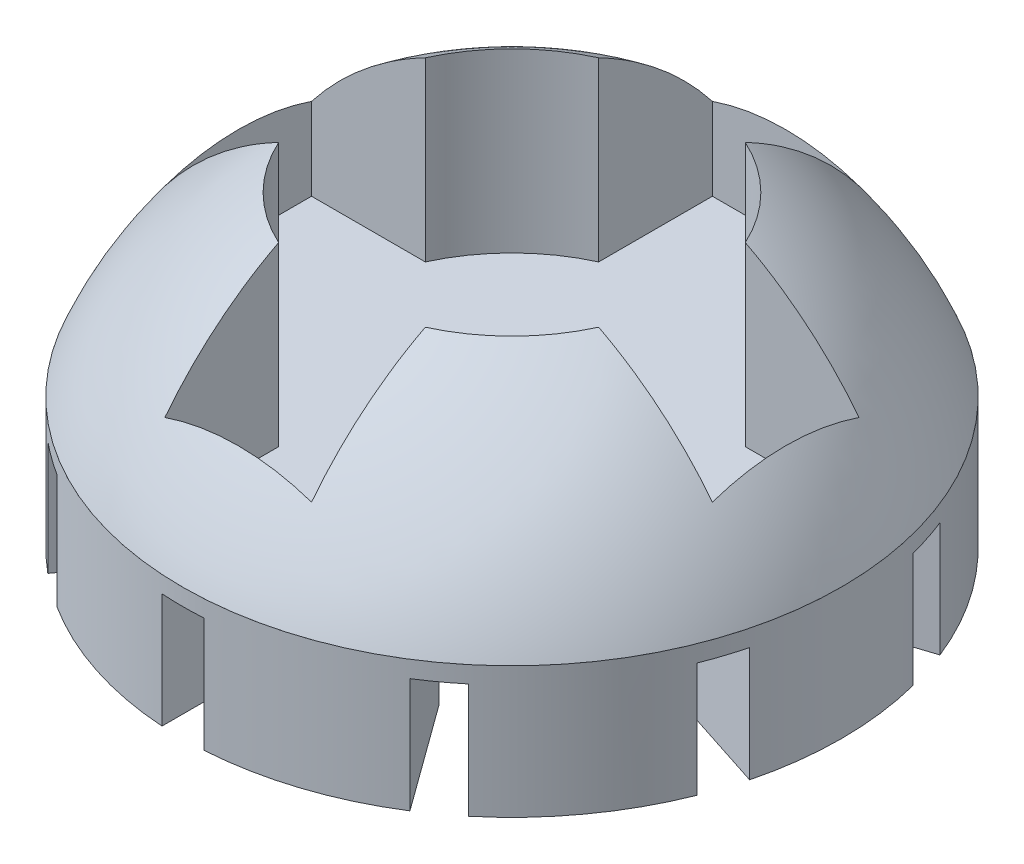
from build123d import *

# Parameters (mm, degrees)
SKETCH1_R           = 29.972
SKETCH1_R_2         = 5.55625
BOSS_EXTRUDE1_DEPTH = 11.938
CUT_EXTRUDE1_DEPTH  = 48.007515717
CUT_EXTRUDE2_DEPTH  = 10.414


with BuildPart() as part:
    # Sketch1 → Boss-Extrude1 (new body)
    with BuildSketch(Plane(origin=(0, 0, 0), x_dir=(1, 0, 0), z_dir=(0, 1, 0))):
        Circle(SKETCH1_R)
        Circle(SKETCH1_R_2, mode=Mode.SUBTRACT)
    extrude(amount=BOSS_EXTRUDE1_DEPTH)

    # Sketch4 → Cut-Extrude2 (cut)
    with BuildSketch(Plane(origin=(0, 0, 0), x_dir=(-1, 0, 0), z_dir=(0, -1, 0))):
        with BuildLine():
            Line((1.905, -31.226313541), (-1.905, -31.226313541))
            Line((-1.905, -31.226313541), (-1.905, -17.933101544))
            ThreePointArc((-1.905, -17.933101544), (-5.572812477, -17.151353215), (-8.999635241, -15.627914817))
            Line((-8.999635241, -15.627914817), (-16.813189209, -26.382349232))
            Line((-16.813189209, -26.382349232), (-19.895543957, -24.142887421))
            Line((-19.895543957, -24.142887421), (-12.08198999, -13.388453006))
            ThreePointArc((-12.08198999, -13.388453006), (-14.589812477, -10.60011924), (-16.466715707, -7.353395803))
            Line((-16.466715707, -7.353395803), (-29.109311599, -11.461224219))
            Line((-29.109311599, -11.461224219), (-30.286666347, -7.837698892))
            Line((-30.286666347, -7.837698892), (-17.644070455, -3.729870476))
            ThreePointArc((-17.644070455, -3.729870476), (-18.034, 0), (-17.644070455, 3.729870476))
            Line((-17.644070455, 3.729870476), (-30.286666347, 7.837698892))
            Line((-30.286666347, 7.837698892), (-29.109311599, 11.461224219))
            Line((-29.109311599, 11.461224219), (-16.466715707, 7.353395803))
            ThreePointArc((-16.466715707, 7.353395803), (-14.589812477, 10.60011924), (-12.08198999, 13.388453006))
            Line((-12.08198999, 13.388453006), (-19.895543957, 24.142887421))
            Line((-19.895543957, 24.142887421), (-16.813189209, 26.382349232))
            Line((-16.813189209, 26.382349232), (-8.999635241, 15.627914817))
            ThreePointArc((-8.999635241, 15.627914817), (-5.572812477, 17.151353215), (-1.905, 17.933101544))
            Line((-1.905, 17.933101544), (-1.905, 31.226313541))
            Line((-1.905, 31.226313541), (1.905, 31.226313541))
            Line((1.905, 31.226313541), (1.905, 17.933101544))
            ThreePointArc((1.905, 17.933101544), (5.572812477, 17.151353215), (8.999635241, 15.627914817))
            Line((8.999635241, 15.627914817), (16.813189209, 26.382349232))
            Line((16.813189209, 26.382349232), (19.895543957, 24.142887421))
            Line((19.895543957, 24.142887421), (12.08198999, 13.388453006))
            ThreePointArc((12.08198999, 13.388453006), (14.589812477, 10.60011924), (16.466715707, 7.353395803))
            Line((16.466715707, 7.353395803), (29.109311599, 11.461224219))
            Line((29.109311599, 11.461224219), (30.286666347, 7.837698892))
            Line((30.286666347, 7.837698892), (17.644070455, 3.729870476))
            ThreePointArc((17.644070455, 3.729870476), (18.034, 0), (17.644070455, -3.729870476))
            Line((17.644070455, -3.729870476), (30.286666347, -7.837698892))
            Line((30.286666347, -7.837698892), (29.109311599, -11.461224219))
            Line((29.109311599, -11.461224219), (16.466715707, -7.353395803))
            ThreePointArc((16.466715707, -7.353395803), (14.589812477, -10.60011924), (12.08198999, -13.388453006))
            Line((12.08198999, -13.388453006), (19.895543957, -24.142887421))
            Line((19.895543957, -24.142887421), (16.813189209, -26.382349232))
            Line((16.813189209, -26.382349232), (8.999635241, -15.627914817))
            ThreePointArc((8.999635241, -15.627914817), (5.572812477, -17.151353215), (1.905, -17.933101544))
            Line((1.905, -17.933101544), (1.905, -31.226313541))
        make_face()
    extrude(amount=-CUT_EXTRUDE2_DEPTH, mode=Mode.SUBTRACT)


with BuildPart() as body_2:
    # Sketch2 → Revolve1 (revolve)
    with BuildSketch(Plane.XY):
        with BuildLine():
            Line((0, 11.938), (29.972, 11.938))
            ThreePointArc((29.972, 11.938), (18.106530244, 26.701876161), (0, 32.261999752))
            Line((0, 32.261999752), (0, 11.938))
        make_face()
    revolve(axis=Axis((0, 49.315518442, 0), (0, -1, 0)))

    # Sketch3 → Cut-Extrude1 (cut, through all)
    with BuildSketch(Plane(origin=(0, 11.938, 0), x_dir=(1, 0, 0), z_dir=(0, 1, 0))):
        with BuildLine():
            Line((-6.6675, 14.546767605), (-6.6675, 24.892))
            Line((-6.6675, 24.892), (6.6675, 24.892))
            Line((6.6675, 24.892), (6.6675, 14.546767605))
            ThreePointArc((6.6675, 14.546767605), (11.315122713, 11.315122713), (14.546767605, 6.6675))
            Line((14.546767605, 6.6675), (24.892, 6.6675))
            Line((24.892, 6.6675), (24.892, -6.6675))
            Line((24.892, -6.6675), (14.546767605, -6.6675))
            ThreePointArc((14.546767605, -6.6675), (11.315122713, -11.315122713), (6.6675, -14.546767605))
            Line((6.6675, -14.546767605), (6.6675, -24.892))
            Line((6.6675, -24.892), (-6.6675, -24.892))
            Line((-6.6675, -24.892), (-6.6675, -14.546767605))
            ThreePointArc((-6.6675, -14.546767605), (-11.315122713, -11.315122713), (-14.546767605, -6.6675))
            Line((-14.546767605, -6.6675), (-24.892, -6.6675))
            Line((-24.892, -6.6675), (-24.892, 6.6675))
            Line((-24.892, 6.6675), (-14.546767605, 6.6675))
            ThreePointArc((-14.546767605, 6.6675), (-11.315122713, 11.315122713), (-6.6675, 14.546767605))
        make_face()
    extrude(amount=CUT_EXTRUDE1_DEPTH, mode=Mode.SUBTRACT)


solid = Compound([part.part, body_2.part])
